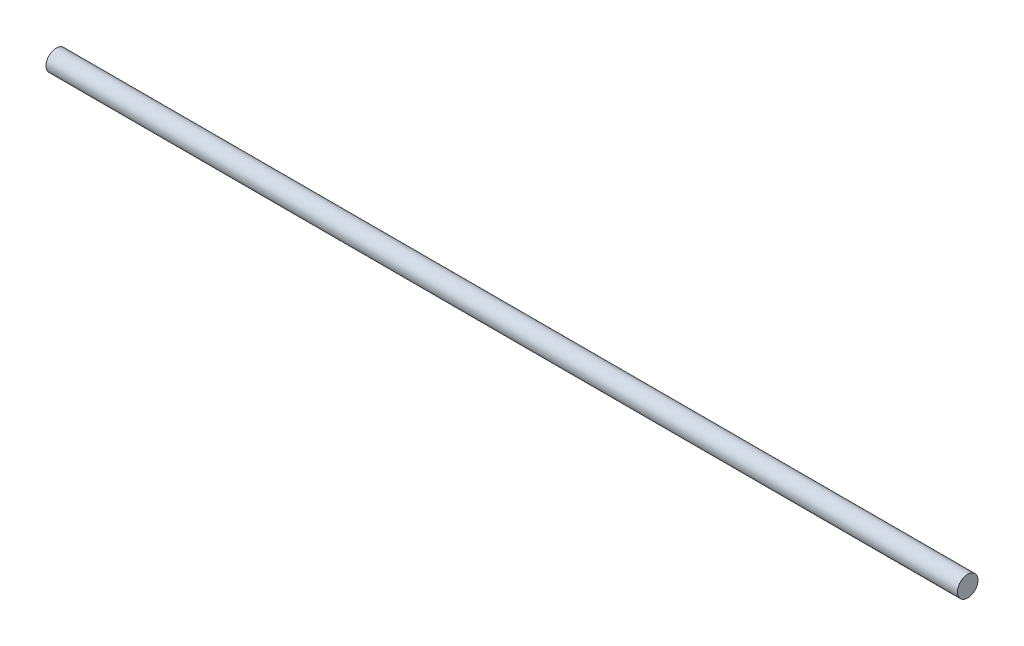
from build123d import *

# Parameters (mm, degrees)
SKETCH1_R           = 1.50495
BOSS_EXTRUDE1_DEPTH = 66.675


with BuildPart() as part:
    # Sketch1 → Boss-Extrude1 (new, symmetric)
    with BuildSketch(Plane(origin=(0, 0, 0), x_dir=(0, 0, -1), z_dir=(1, 0, 0))):
        Circle(SKETCH1_R)
    extrude(amount=BOSS_EXTRUDE1_DEPTH, both=True)


solid = part.part
